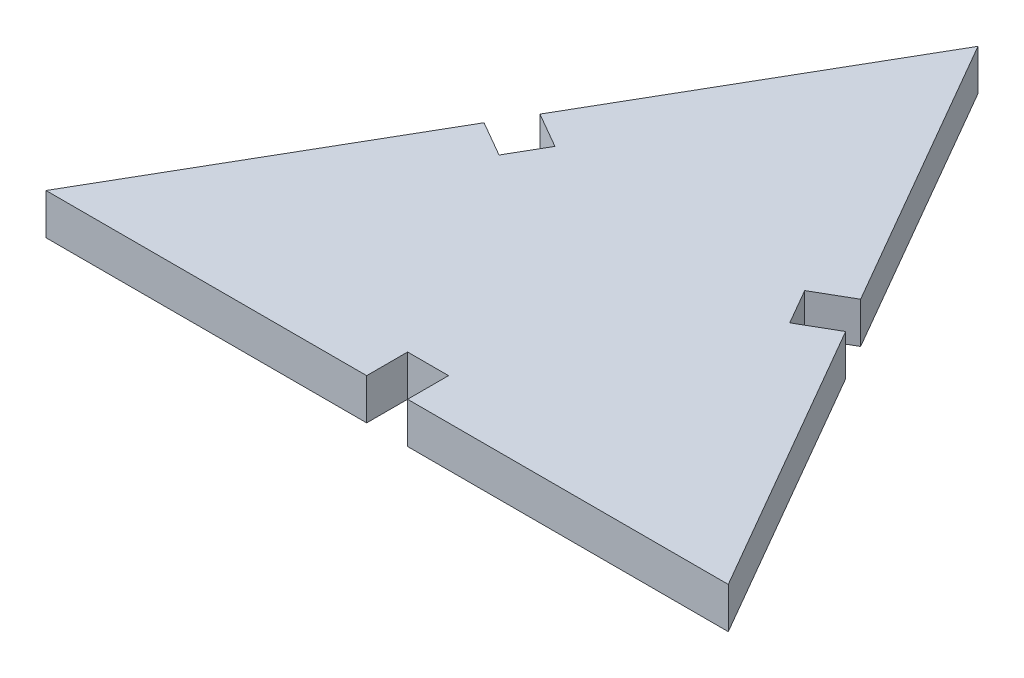
from build123d import *

# Parameters (mm, degrees)
BOSS_EXTRUDE1_DEPTH = 3
CUT_EXTRUDE1_REACH  = 38.91
SKETCH3_W           = 3
SKETCH3_H           = 3


with BuildPart() as part:
    # Sketch1 → Boss-Extrude1 (new body)
    with BuildSketch(Plane(origin=(0, 0, 0), x_dir=(1, 0, 0), z_dir=(0, 1, 0))):
        Polygon((0.480769231, 26.534443266), (-24.519230769, -16.766826923), (25.480769231, -16.766826923), align=None)
    extrude(amount=BOSS_EXTRUDE1_DEPTH)

    # Sketch3 → Cut-Extrude1 (cut, up to next)
    with BuildSketch(Plane(origin=(0, 3, 0), x_dir=(1, 0, 0), z_dir=(0, 1, 0)), mode=Mode.PRIVATE) as cut_extrude1_sk1:
        Polygon((-12.769230769, 3.584770066), (-10.171154558, 2.084770066), (-8.671154558, 4.682846277), (-11.269230769, 6.182846277), align=None)
    cut_extrude1_tool1 = extrude(cut_extrude1_sk1.sketch, amount=-CUT_EXTRUDE1_REACH, mode=Mode.PRIVATE) & part.part
    # Sketch3 → Cut-Extrude1 (cut, up to next)
    with BuildSketch(Plane(origin=(0, 3, 0), x_dir=(1, 0, 0), z_dir=(0, 1, 0)), mode=Mode.PRIVATE) as cut_extrude1_sk2:
        Polygon((13.730769231, 3.584770066), (11.132693019, 2.084770066), (9.632693019, 4.682846277), (12.230769231, 6.182846277), align=None)
    cut_extrude1_tool2 = extrude(cut_extrude1_sk2.sketch, amount=-CUT_EXTRUDE1_REACH, mode=Mode.PRIVATE) & part.part
    # Sketch3 → Cut-Extrude1 (cut, up to next)
    with BuildSketch(Plane(origin=(0, 3, 0), x_dir=(1, 0, 0), z_dir=(0, 1, 0)), mode=Mode.PRIVATE) as cut_extrude1_sk3:
        with Locations((0.480769231, -15.266826923)):
            Rectangle(SKETCH3_W, SKETCH3_H)
    cut_extrude1_tool3 = extrude(cut_extrude1_sk3.sketch, amount=-CUT_EXTRUDE1_REACH, mode=Mode.PRIVATE) & part.part
    add(cut_extrude1_tool1.solids().sort_by_distance((-10.720193, 3, -4.133808))[0], mode=Mode.SUBTRACT)
    add(cut_extrude1_tool2.solids().sort_by_distance((11.681731, 3, -4.133808))[0], mode=Mode.SUBTRACT)
    add(cut_extrude1_tool3.solids().sort_by_distance((0.480769, 3, 15.266827))[0], mode=Mode.SUBTRACT)


solid = part.part
